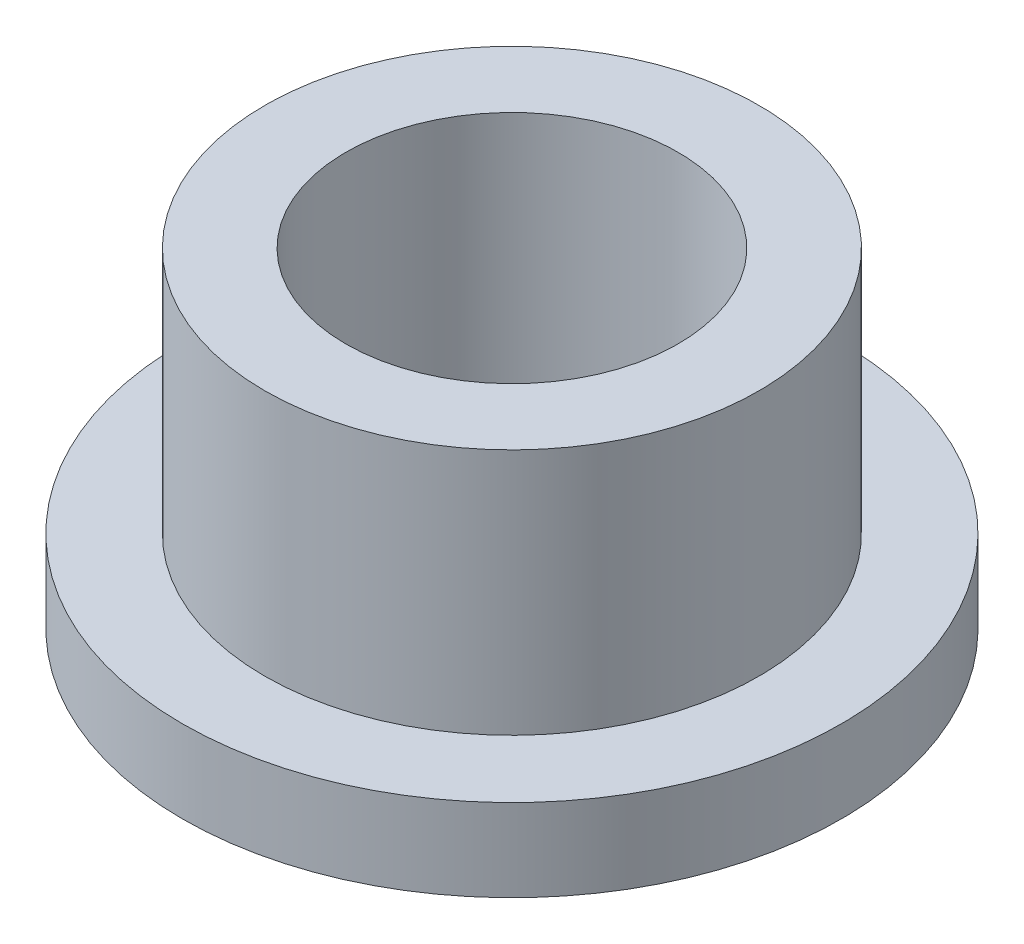
from build123d import *

# Parameters (mm, degrees)
SKETCH2_R           = 4.7625
SKETCH2_R_2         = 3.2004
BOSS_EXTRUDE1_DEPTH = 6.35
SKETCH3_R           = 6.35
SKETCH3_R_2         = 4.7625
BOSS_EXTRUDE2_DEPTH = 1.5875


with BuildPart() as part:
    # Sketch2 → Boss-Extrude1 (new body)
    with BuildSketch(Plane(origin=(0, 0, 0), x_dir=(1, 0, 0), z_dir=(0, 1, 0))):
        Circle(SKETCH2_R)
        Circle(SKETCH2_R_2, mode=Mode.SUBTRACT)
    extrude(amount=BOSS_EXTRUDE1_DEPTH)

    # Sketch3 → Boss-Extrude2 (add)
    with BuildSketch(Plane(origin=(0, 0, 0), x_dir=(1, 0, 0), z_dir=(0, 1, 0))):
        Circle(SKETCH3_R)
        Circle(SKETCH3_R_2, mode=Mode.SUBTRACT)
    extrude(amount=BOSS_EXTRUDE2_DEPTH)


solid = part.part
